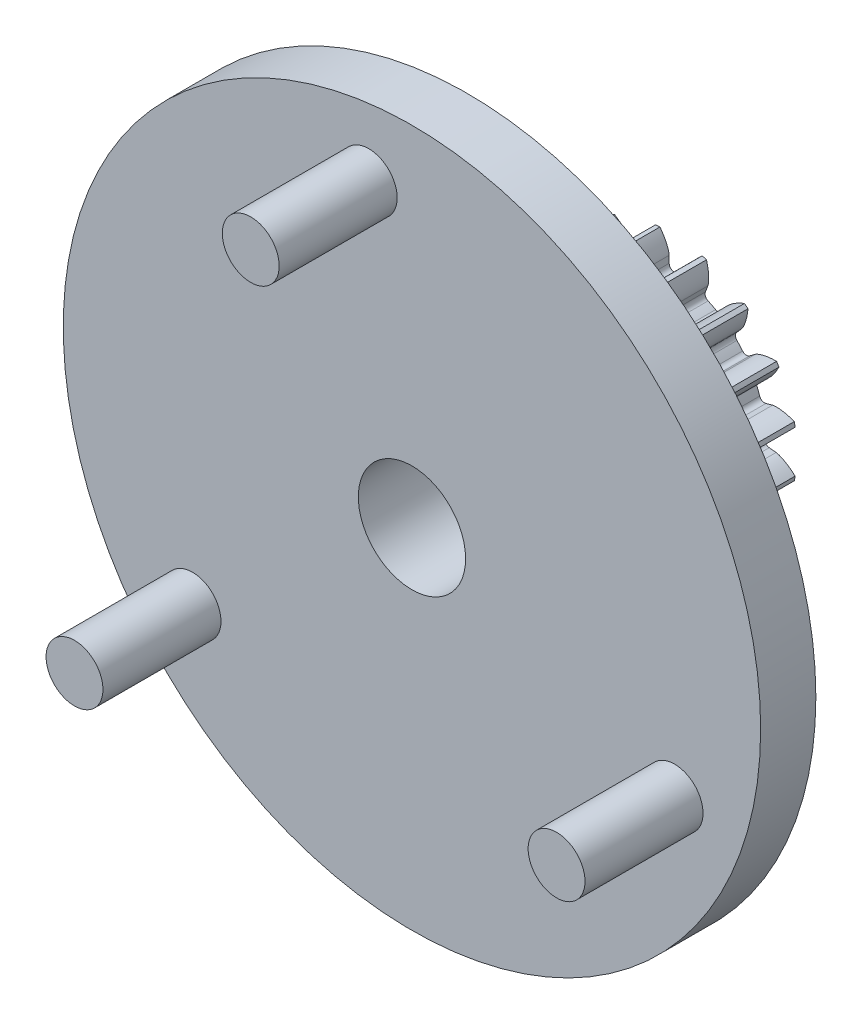
from build123d import *

# Parameters (mm, degrees)
BLANK_SKETCH_R      = 11.875
BLANK_DEPTH         = 5
TOOTH_SPACE_DEPTH   = 18.522307211
TEETH_COUNT         = 17
BORE_DEPTH          = 18.499960093
BORE_DEPTH_BACK     = 18.499960093
BORE_SKETCH_R       = 5
SKETCH1_R           = 32.5
SKETCH1_R_2         = 2.65
SKETCH1_R_3         = 5
BOSS_EXTRUDE1_DEPTH = 5
BOSS_EXTRUDE2_START = 14
SKETCH3_R           = 8.75
SKETCH3_R_2         = 5
BOSS_EXTRUDE2_DEPTH = 14
CHAMFER2_SIZE       = 13.856406461
CHAMFER2_SIZE_2     = 24
SKETCH1_5_R         = 2.65
BOSS_EXTRUDE3_DEPTH = 11
CIRPATTERN1_COUNT   = 3


with BuildPart() as part:
    # Blank Sketch → Blank (new body)
    with BuildSketch(Plane.XY):
        Circle(BLANK_SKETCH_R)
    extrude(amount=BLANK_DEPTH)

    # Tooth Space Sketch → Tooth Space (cut, symmetric)
    with BuildSketch(Plane.XY):
        with BuildLine():
            Line((9.939079093, 0.948492097), (9.295694704, 0.887093551))
            ThreePointArc((9.295694704, 0.887093551), (8.98235795, 0.725899492), (8.866285625, 0.393197431))
            ThreePointArc((8.866285625, 0.393197431), (8.875, 0), (8.866285625, -0.393197431))
            ThreePointArc((8.866285625, -0.393197431), (8.98235795, -0.725899492), (9.295694704, -0.887093551))
            Line((9.295694704, -0.887093551), (9.939079093, -0.948492097))
            add(Edge.make_bspline(
                [(9.939079093, -0.948492097), (9.944419956, -0.949099255), (9.959363538, -0.951100483), (9.987461284, -0.956060515), (10.033024977, -0.965815194), (10.090612537, -0.980674949), (10.164414462, -1.002652043), (10.250457009, -1.032080202), (10.343964765, -1.068095975), (10.444451681, -1.11120542), (10.543514859, -1.15765376), (10.641151163, -1.207155784), (10.737293163, -1.259303994), (10.852346672, -1.325781398), (10.988299107, -1.410072048), (11.14406597, -1.515140112), (11.316856551, -1.641938971), (11.488524989, -1.779131562), (11.653706097, -1.920614485), (11.816027404, -2.070803406), (11.969819819, -2.2212394), (12.124556639, -2.38463298), (12.26486155, -2.539111634), (12.416223734, -2.71980126), (12.536695511, -2.867871874), (12.656096039, -3.026982739), (12.713455505, -3.105320734), (12.742448933, -3.145730469)],
                knots=[0, 0, 0, 0, 0, 0.005376748, 0.015083688, 0.02853182, 0.046610139, 0.064854849, 0.092110525, 0.119476176, 0.146842495, 0.174208854, 0.201574955, 0.228941013, 0.256307345, 0.307035032, 0.361767351, 0.41649966, 0.471231936, 0.525964282, 0.580696615, 0.635428982, 0.690161387, 0.744893688, 0.799626082, 0.854358408, 0.909090915, 0.909090915, 0.909090915, 0.909090915, 0.909090915], degree=4))
            Line((12.742448933, -3.145730469), (12.742448933, 3.145730469))
            add(Edge.make_bspline(
                [(9.939079093, 0.948492097), (9.944419956, 0.949099255), (9.959363538, 0.951100483), (9.987461284, 0.956060515), (10.033024977, 0.965815194), (10.090612537, 0.980674949), (10.164414462, 1.002652043), (10.250457009, 1.032080202), (10.343964765, 1.068095975), (10.444451681, 1.11120542), (10.543514859, 1.15765376), (10.641151163, 1.207155784), (10.737293163, 1.259303994), (10.852346672, 1.325781398), (10.988299107, 1.410072048), (11.14406597, 1.515140112), (11.316856551, 1.641938971), (11.488524989, 1.779131562), (11.653706097, 1.920614485), (11.816027404, 2.070803406), (11.969819819, 2.2212394), (12.124556639, 2.38463298), (12.26486155, 2.539111634), (12.416223734, 2.71980126), (12.536695511, 2.867871874), (12.656096039, 3.026982739), (12.713455505, 3.105320734), (12.742448933, 3.145730469)],
                knots=[0, 0, 0, 0, 0, 0.005376748, 0.015083688, 0.02853182, 0.046610139, 0.064854849, 0.092110525, 0.119476176, 0.146842495, 0.174208854, 0.201574955, 0.228941013, 0.256307345, 0.307035032, 0.361767351, 0.41649966, 0.471231936, 0.525964282, 0.580696615, 0.635428982, 0.690161387, 0.744893688, 0.799626082, 0.854358408, 0.909090915, 0.909090915, 0.909090915, 0.909090915, 0.909090915], degree=4))
        make_face()
    tooth_space = extrude(amount=TOOTH_SPACE_DEPTH, both=True, mode=Mode.SUBTRACT)

    # Teeth: Tooth Space ×17 about axis
    teeth_axis = Axis((0, 0, -0.25007105), (0, 0, 1))
    for i in range(1, TEETH_COUNT):
        add(tooth_space.rotate(teeth_axis, i * 360 / TEETH_COUNT), mode=Mode.SUBTRACT)

    # Bore Sketch → Bore (cut, two sides: drawn at the far end of the back side and taken through both)
    with BuildSketch(Plane.XY.offset(-BORE_DEPTH_BACK)):
        Circle(BORE_SKETCH_R)
    extrude(amount=BORE_DEPTH + BORE_DEPTH_BACK, mode=Mode.SUBTRACT)



with BuildPart() as body_2:
    # Sketch1 → Boss-Extrude1 (new body)
    # profile 1 of 2: a face of its own
    with BuildSketch(Plane.XY.offset(24)):
        Circle(SKETCH1_R)
        with Locations((-4.02653094, 25.939343642)):
            Circle(SKETCH1_R_2, mode=Mode.SUBTRACT)
        Circle(SKETCH1_R_3, mode=Mode.SUBTRACT)
    # profile 2 of 2: a face of its own
    with BuildSketch(Plane.XY.offset(24)):
        with Locations((-4.02653094, 25.939343642)):
            Circle(SKETCH1_R_2)
    extrude(amount=-BOSS_EXTRUDE1_DEPTH)


with BuildPart() as part_1:
    add(part.part)

    add(body_2.part)  # Boss-Extrude2 merges body 2
    # Sketch3 → Boss-Extrude2 (add)
    with BuildSketch(Plane(origin=(0, 0, 19), x_dir=(-1, 0, 0), z_dir=(0, 0, -1)).offset(BOSS_EXTRUDE2_START)):
        with Locations(Location((0, 0, 0), (0, 0, 180))):
            Circle(SKETCH3_R)
        with Locations(Location((0, 0, 0), (0, 0, 180))):
            Circle(SKETCH3_R_2, mode=Mode.SUBTRACT)
    extrude(amount=-BOSS_EXTRUDE2_DEPTH)

    # Chamfer2
    # the kernel refuses this chamfer: 24, 13.856406461 mm, written as the material it adds along each edge
    with BuildSketch(Plane(origin=(0, 0, 19), x_dir=(1, 0, 0), z_dir=(0, 1, 0))) as chamfer2_piece_1_section:
        Polygon((8.75, CHAMFER2_SIZE), (8.75 + CHAMFER2_SIZE_2, 0), (8.75, 0), align=None)
    chamfer2_piece_1 = revolve(axis=Axis((0, 0, 19), (0, 0, -1)), mode=Mode.PRIVATE)
    chamfer2_piece_1 = chamfer2_piece_1 & Plane(origin=(0, 0, 11.993735061), x_dir=(1, 0, 0), z_dir=(0, 0, 1)) * Cylinder(32.5, 131, mode=Mode.PRIVATE)
    add(chamfer2_piece_1)

    # Sketch1<5> → Boss-Extrude3 (add)
    with BuildSketch(Plane.XY.offset(24)):
        with Locations((-4.02653094, 25.939343642)):
            Circle(SKETCH1_5_R)
    boss_extrude3 = extrude(amount=BOSS_EXTRUDE3_DEPTH)

    # CirPattern1: Boss-Extrude3 ×3 about axis
    cirpattern1_axis = Axis((0, 0, 0), (0, 0, 1))
    for i in range(1, CIRPATTERN1_COUNT):
        add(boss_extrude3.rotate(cirpattern1_axis, i * 360 / CIRPATTERN1_COUNT))


solid = part_1.part
